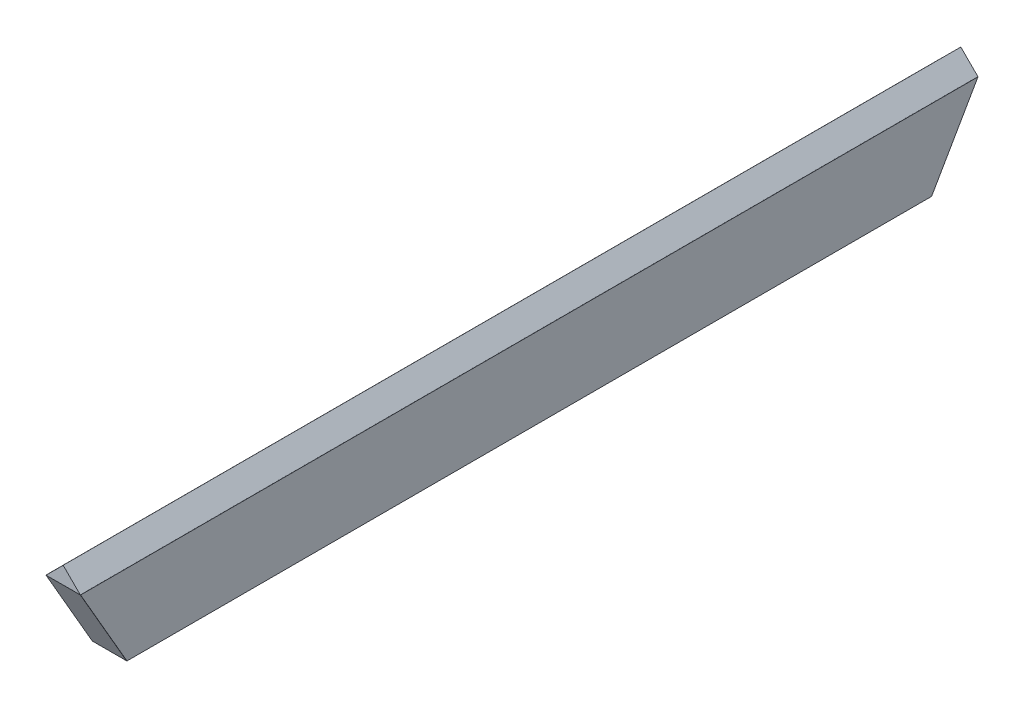
from build123d import *
from OCP.BRepFilletAPI import BRepFilletAPI_MakeChamfer

# Parameters (mm, degrees)
SKETCH1_W           = 3
SKETCH1_H           = 7
BOSS_EXTRUDE1_DEPTH = 39
DRAFT1_ANGLE        = -30
DRAFT2_ANGLE        = -30
CHAMFER1_SIZE       = 0.01
CHAMFER2_SIZE       = 0.01
CHAMFER2_SIZE_2     = 0.007320508
CHAMFER2_SIZE_3     = 0.027320508
CHAMFER2_SIZE_4     = 0.007758146
CHAMFER2_SIZE_5     = 0.017186236
BOSS_EXTRUDE2_START = 38.99634
BOSS_EXTRUDE2_DEPTH = 77.98554


with BuildPart() as part:
    # Sketch1 → Boss-Extrude1 (new, symmetric)
    with BuildSketch(Plane.XY):
        Rectangle(SKETCH1_W, SKETCH1_H)
    extrude(amount=BOSS_EXTRUDE1_DEPTH, both=True)

    # Draft1
    draft1_faces = [part.faces().sort_by_distance(p)[0] for p in [
        (0, 0, 39),
    ]]
    draft(draft1_faces, Plane(origin=(1.5, 3.5, 39), x_dir=(1, 0, 0), z_dir=(0, 1, 0)), DRAFT1_ANGLE)

    # Draft2
    draft2_faces = [part.faces().sort_by_distance(p)[0] for p in [
        (0, 0, -39),
    ]]
    draft(draft2_faces, Plane(origin=(1.5, 3.5, 39), x_dir=(1, 0, 0), z_dir=(0, 1, 0)), DRAFT2_ANGLE)

    # Chamfer1
    chamfer1_edges = [part.edges().sort_by_distance(p)[0] for p in [
        (-1.5, 3.5, 0),
        (1.5, 3.5, 0),
        (1.5, -3.5, 0),
        (-1.5, -3.5, 0),
    ]]
    chamfer(chamfer1_edges, length=CHAMFER1_SIZE)

    # Chamfer2
    chamfer2_edges_1 = [part.edges().sort_by_distance(p)[0] for p in [
        (0, 3.5, -39),
    ]]
    chamfer2_side_1 = [part.faces().sort_by_distance(p)[0] for p in [
        (0, 3.499873205, -38.999926795),
    ]]
    chamfer2_edges_2 = [part.edges().sort_by_distance(p)[0] for p in [
        (0, -3.5, -34.958548116),
    ]]
    chamfer2_side_2 = [part.faces().sort_by_distance(p)[0] for p in [
        (0, -3.5, -34.958348116),
    ]]
    chamfer2_edges_3 = [part.edges().sort_by_distance(p)[0] for p in [
        (1.495, 3.495, -38.997113249),
    ]]
    chamfer2_side_3 = [part.faces().sort_by_distance(p)[0] for p in [
        (1.494882708, 3.494912031, -38.99706246),
    ]]
    chamfer2_edges_4 = [part.edges().sort_by_distance(p)[0] for p in [
        (1.495, 3.495, 38.997113249),
    ]]
    chamfer2_side_4 = [part.faces().sort_by_distance(p)[0] for p in [
        (1.494882708, 3.494912031, 38.99706246),
    ]]
    chamfer2_edges_5 = [part.edges().sort_by_distance(p)[0] for p in [
        (-1.495, 3.495, -38.997113249),
    ]]
    chamfer2_side_5 = [part.faces().sort_by_distance(p)[0] for p in [
        (-1.494882708, 3.494912031, -38.99706246),
    ]]
    chamfer2_edges_6 = [part.edges().sort_by_distance(p)[0] for p in [
        (-1.495, 3.495, 38.997113249),
    ]]
    chamfer2_side_6 = [part.faces().sort_by_distance(p)[0] for p in [
        (-1.494882708, 3.494912031, 38.99706246),
    ]]
    chamfer2_edges_7 = [part.edges().sort_by_distance(p)[0] for p in [
        (0, 3.5, 39),
    ]]
    chamfer2_side_7 = [part.faces().sort_by_distance(p)[0] for p in [
        (0, 3.499873205, 38.999926795),
    ]]
    chamfer2_edges_8 = [part.edges().sort_by_distance(p)[0] for p in [
        (0, -3.5, 34.958548116),
    ]]
    chamfer2_side_8 = [part.faces().sort_by_distance(p)[0] for p in [
        (0, -3.5, 34.958348116),
    ]]
    chamfer2 = BRepFilletAPI_MakeChamfer(part.part.solid().wrapped)
    for e in chamfer2_edges_1:
        chamfer2.Add(CHAMFER2_SIZE, CHAMFER2_SIZE_2, e.wrapped, chamfer2_side_1[0].wrapped)
    for e in chamfer2_edges_2:
        chamfer2.Add(CHAMFER2_SIZE_3, CHAMFER2_SIZE, e.wrapped, chamfer2_side_2[0].wrapped)
    for e in chamfer2_edges_3:
        chamfer2.Add(CHAMFER2_SIZE_4, CHAMFER2_SIZE, e.wrapped, chamfer2_side_3[0].wrapped)
    for e in chamfer2_edges_4:
        chamfer2.Add(CHAMFER2_SIZE_4, CHAMFER2_SIZE, e.wrapped, chamfer2_side_4[0].wrapped)
    for e in chamfer2_edges_5:
        chamfer2.Add(CHAMFER2_SIZE_4, CHAMFER2_SIZE, e.wrapped, chamfer2_side_5[0].wrapped)
    for e in chamfer2_edges_6:
        chamfer2.Add(CHAMFER2_SIZE_4, CHAMFER2_SIZE, e.wrapped, chamfer2_side_6[0].wrapped)
    for e in chamfer2_edges_7:
        chamfer2.Add(CHAMFER2_SIZE_2, CHAMFER2_SIZE, e.wrapped, chamfer2_side_7[0].wrapped)
    for e in chamfer2_edges_8:
        chamfer2.Add(CHAMFER2_SIZE, CHAMFER2_SIZE_3, e.wrapped, chamfer2_side_8[0].wrapped)
    add(Compound.cast(chamfer2.Shape()), mode=Mode.REPLACE)
    chamfer2_2_edges_1 = [part.edges().sort_by_distance(p)[0] for p in [
        (1.499330127, -3.490669873, -34.963934867),
    ]]
    chamfer2_2_side_1 = [part.faces().sort_by_distance(p)[0] for p in [
        (1.499383579, -3.490616421, -34.963749703),
    ]]
    chamfer2_2_edges_2 = [part.edges().sort_by_distance(p)[0] for p in [
        (-1.499330127, -3.490669873, -34.963934867),
    ]]
    chamfer2_2_side_2 = [part.faces().sort_by_distance(p)[0] for p in [
        (-1.499383579, -3.490616421, -34.963749703),
    ]]
    chamfer2_2 = BRepFilletAPI_MakeChamfer(part.part.solid().wrapped)
    for e in chamfer2_2_edges_1:
        chamfer2_2.Add(CHAMFER2_SIZE, CHAMFER2_SIZE_5, e.wrapped, chamfer2_2_side_1[0].wrapped)
    for e in chamfer2_2_edges_2:
        chamfer2_2.Add(CHAMFER2_SIZE, CHAMFER2_SIZE_5, e.wrapped, chamfer2_2_side_2[0].wrapped)
    add(Compound.cast(chamfer2_2.Shape()), mode=Mode.REPLACE)
    chamfer2_3_edges = [part.edges().sort_by_distance(p)[0] for p in [
        (-1.5, 0.006236096, -36.982874469),
        (-1.5, 0.001698596, 36.980254743),
        (1.5, 0.006236096, -36.982874469),
        (1.5, 0.001698596, 36.980254743),
    ]]
    chamfer(chamfer2_3_edges, length=CHAMFER2_SIZE)

    # Sketch2 → Boss-Extrude2 (add)
    with BuildSketch(Plane.XY.offset(BOSS_EXTRUDE2_START)):
        Polygon((1.486692701, 3.5), (0, 4.983222747), (-1.49, 3.489736937), align=None)
    extrude(amount=-BOSS_EXTRUDE2_DEPTH)


solid = part.part
